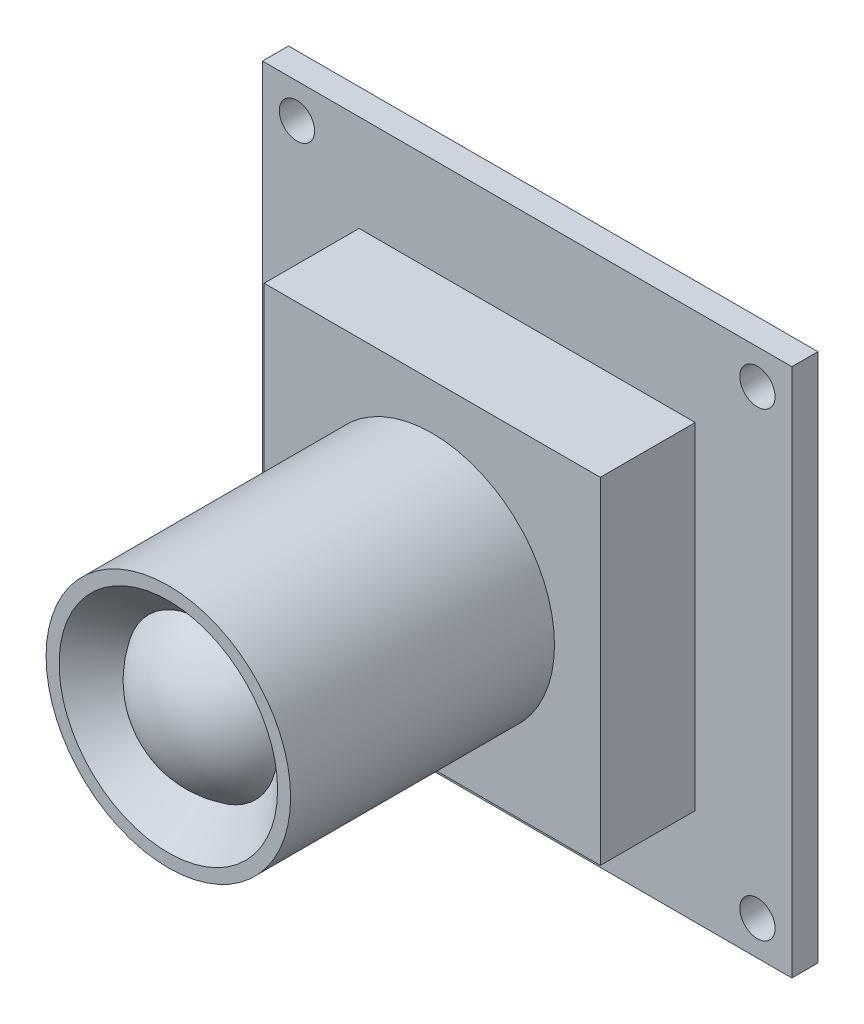
from build123d import *

# Parameters (mm, degrees)
SKETCH1_W           = 32.004
SKETCH1_H           = 32.004
BOSS_EXTRUDE1_DEPTH = 1.5748
SKETCH2_W           = 20.32
SKETCH2_H           = 20.32
BOSS_EXTRUDE2_DEPTH = 5.7404
SKETCH3_R           = 7.3914
BOSS_EXTRUDE3_DEPTH = 15.9512
SKETCH4_R           = 1.0668
CUT_EXTRUDE1_DEPTH  = 15.9512
SKETCH5_R           = 3.81
CUT_EXTRUDE2_DEPTH  = 2.032
CHAMFER1_SIZE       = 2.794
DOME2_FACE_RADIUS   = 4.572
DOME2_HEIGHT        = 2.54


with BuildPart() as part:
    # Sketch1 → Boss-Extrude1 (new body)
    with BuildSketch(Plane.XY):
        Rectangle(SKETCH1_W, SKETCH1_H)
    extrude(amount=BOSS_EXTRUDE1_DEPTH)

    # Sketch2 → Boss-Extrude2 (add)
    with BuildSketch(Plane.XY.offset(1.5748)):
        Rectangle(SKETCH2_W, SKETCH2_H)
    extrude(amount=BOSS_EXTRUDE2_DEPTH)

    # Sketch3 → Boss-Extrude3 (add)
    with BuildSketch(Plane.XY.offset(7.3152)):
        Circle(SKETCH3_R)
    extrude(amount=BOSS_EXTRUDE3_DEPTH)

    # Sketch4 → Cut-Extrude1 (cut)
    with BuildSketch(Plane.XY.offset(1.5748)):
        with Locations((-13.9192, 13.9192)):
            Circle(SKETCH4_R)
        with Locations((-13.9192, -13.9192)):
            Circle(SKETCH4_R)
        with Locations((13.9192, 13.9192)):
            Circle(SKETCH4_R)
        with Locations((13.9192, -13.9192)):
            Circle(SKETCH4_R)
    extrude(amount=-CUT_EXTRUDE1_DEPTH, mode=Mode.SUBTRACT)

    # Sketch5 → Cut-Extrude2 (cut)
    with BuildSketch(Plane.XY.offset(23.2664)):
        Circle(SKETCH5_R)
    extrude(amount=-CUT_EXTRUDE2_DEPTH, mode=Mode.SUBTRACT)

    # Chamfer1
    # the kernel refuses this chamfer: 2.794 mm, written as the material it takes off along each edge
    with BuildSketch(Plane(origin=(0, 0, 23.2664), x_dir=(1, 0, 0), z_dir=(0, -1, 0))) as chamfer1_piece_1_section:
        Polygon((3.81 + CHAMFER1_SIZE, 0), (3.81, -CHAMFER1_SIZE), (3.81, 0), align=None)
    chamfer1_piece_1 = revolve(axis=Axis((0, 0, 23.2664), (0, 0, 1)), mode=Mode.PRIVATE)
    chamfer1_piece_1 = split(chamfer1_piece_1, bisect_by=Plane(origin=(-5.592803541, 0, 21.2344), z_dir=(0, 0, 1)), keep=Keep.TOP, mode=Mode.PRIVATE)
    add(chamfer1_piece_1, mode=Mode.SUBTRACT)

    # Dome2: a dome of height H over a round flat face of radius A is a cap of a sphere of radius (A * A + H * H) / (2 * H)
    dome2_r = (DOME2_FACE_RADIUS * DOME2_FACE_RADIUS + DOME2_HEIGHT * DOME2_HEIGHT) / (2 * DOME2_HEIGHT)
    dome2_base = Plane((0, 0, 21.2344), z_dir=(0, 0, 1))
    with Locations(dome2_base.offset(DOME2_HEIGHT - dome2_r)):
        dome2_ball = Sphere(dome2_r, mode=Mode.PRIVATE)
    add(split(dome2_ball, bisect_by=dome2_base, keep=Keep.TOP, mode=Mode.PRIVATE))


solid = part.part
